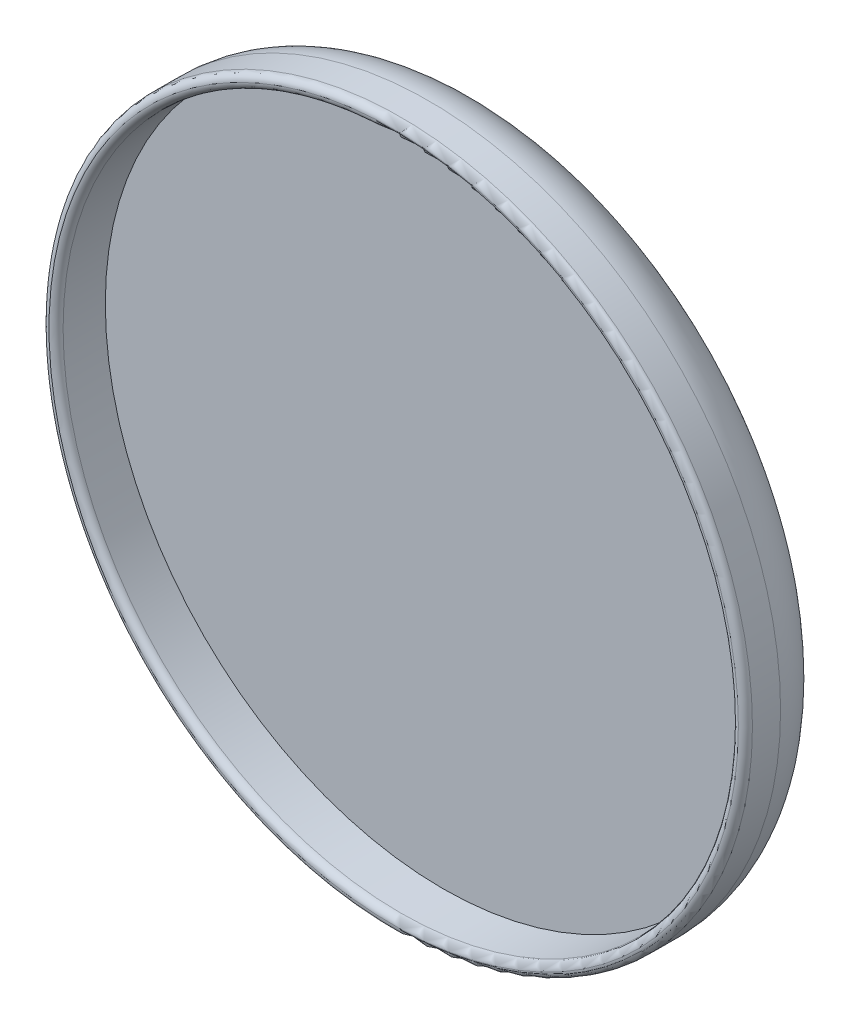
from build123d import *

# Parameters (mm, degrees)
BOSS_EXTRUDE1_DEPTH      = 3.75
BOSS_EXTRUDE1_DEPTH_BACK = 3.5
SKETCH1_R                = 1.95
SKETCH2_R                = 25
BOSS_EXTRUDE2_DEPTH      = 3
SKETCH3_R                = 25
SKETCH3_R_2              = 24
BOSS_EXTRUDE3_DEPTH      = 3.5
FILLET1_R                = 0.5
FILLET2_R                = 4
CHAMFER1_SIZE            = 3
CHAMFER1_SIZE2           = 3.331837544
FILLET3_R                = 1


with BuildPart() as part:
    # Sketch1 → Boss-Extrude1 (new, two sides: drawn at the far end of the back side and taken through both)
    with BuildSketch(Plane.XY.offset(-BOSS_EXTRUDE1_DEPTH_BACK)):
        Circle(SKETCH1_R)
    extrude(amount=BOSS_EXTRUDE1_DEPTH + BOSS_EXTRUDE1_DEPTH_BACK)

    # Sketch2 → Boss-Extrude2 (add)
    with BuildSketch(Plane.XY.offset(3.75)):
        with Locations((0, 14.750067334)):
            Circle(SKETCH2_R)
    extrude(amount=BOSS_EXTRUDE2_DEPTH)

    # Sketch3 → Boss-Extrude3 (add)
    with BuildSketch(Plane.XY.offset(6.75)):
        with Locations((0, 14.750067334)):
            Circle(SKETCH3_R)
        with Locations((0, 14.750067334)):
            Circle(SKETCH3_R_2, mode=Mode.SUBTRACT)
    extrude(amount=BOSS_EXTRUDE3_DEPTH)

    # Fillet1
    fillet1_edges = [part.edges().sort_by_distance(p)[0] for p in [
        (-25, 14.750067334, 10.25),
        (-24, 14.750067334, 10.25),
    ]]
    fillet(fillet1_edges, radius=FILLET1_R - 0.0001)  # a hair under: the kernel refuses the full size

    # Fillet2
    fillet2_edges = [part.edges().sort_by_distance(p)[0] for p in [
        (-25, 14.750067334, 3.75),
    ]]
    fillet(fillet2_edges, radius=FILLET2_R)

    # Chamfer1
    chamfer1_edges = [part.edges().sort_by_distance(p)[0] for p in [
        (-1.95, 0, 3.75),
    ]]
    chamfer1_side = [part.faces().sort_by_distance(p)[0] for p in [
        (-1.95, 0, 1.875),
    ]]
    chamfer(chamfer1_edges, length=CHAMFER1_SIZE, length2=CHAMFER1_SIZE2, reference=chamfer1_side[0])

    # Fillet3
    fillet3_edges = [part.edges().sort_by_distance(p)[0] for p in [
        (-1.95, 0, -3.5),
    ]]
    fillet(fillet3_edges, radius=FILLET3_R)


solid = part.part
